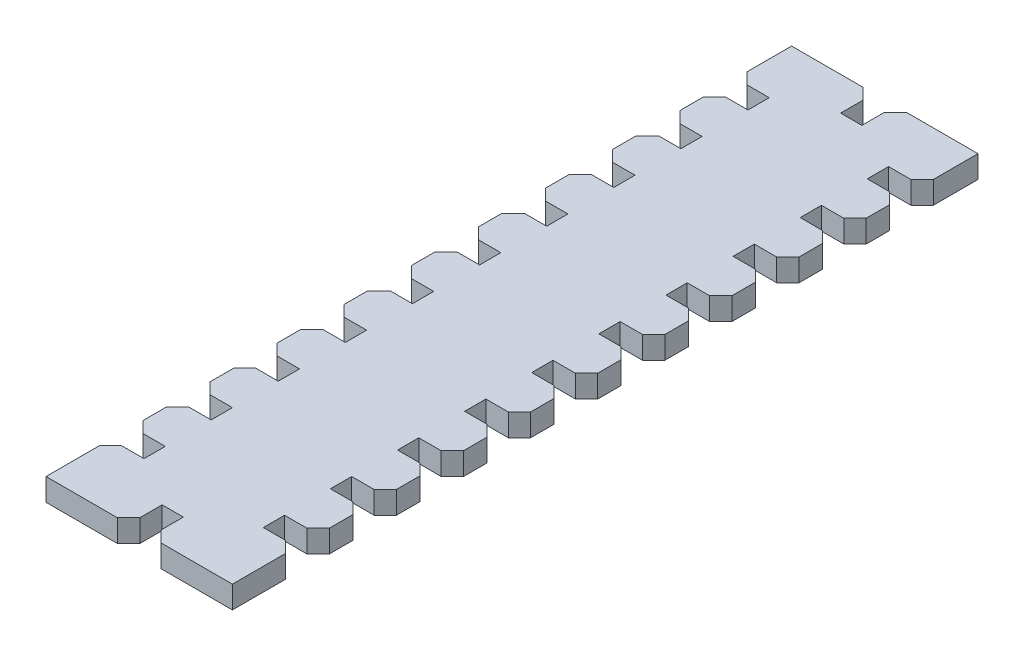
from build123d import *

# Parameters (mm, degrees)
SKETCH1_W                  = 50
SKETCH1_H                  = 200
BOSS_EXTRUDE1_DEPTH        = 6
SKETCH2_W                  = 5.7
SKETCH2_H                  = 9
CUT_EXTRUDE1_DEPTH         = 6
CHAMFER2_SIZE              = 3
SKETCH3_W                  = 9
SKETCH3_H                  = 5.7
CUT_EXTRUDE2_DEPTH         = 10
CHAMFER3_SIZE              = 3
LPATTERN1_COUNT            = 10
LPATTERN1_PITCH            = 18
CHAMFER3_OF_LPATTERN1_SIZE = 3
MIRROR3_DEPTH              = 6


# Read off the part's stored shape, not the designer's step: Mirror3
with BuildPart() as part:
    # Sketch1 → Boss-Extrude1 (new body)
    with BuildSketch(Plane(origin=(0, 0, 0), x_dir=(1, 0, 0), z_dir=(0, 1, 0))):
        with Locations((25, 100)):
            Rectangle(SKETCH1_W, SKETCH1_H)
    extrude(amount=BOSS_EXTRUDE1_DEPTH)

    # Sketch2 → Cut-Extrude1 (cut)
    with BuildSketch(Plane(origin=(0, 6, 0), x_dir=(1, 0, 0), z_dir=(0, 1, 0))):
        with Locations((25, 195.5)):
            Rectangle(SKETCH2_W, SKETCH2_H)
        with Locations((25, 4.5)):
            Rectangle(SKETCH2_W, SKETCH2_H)
    extrude(amount=-CUT_EXTRUDE1_DEPTH, mode=Mode.SUBTRACT)

    # Chamfer2
    chamfer2_edges = [part.edges().sort_by_distance(p)[0] for p in [
        (22.15, 3, -200),
        (27.85, 3, -200),
        (27.85, 3, 0),
        (22.15, 3, 0),
    ]]
    chamfer(chamfer2_edges, length=CHAMFER2_SIZE)

    # Sketch3 → Cut-Extrude2 (cut)
    with BuildSketch(Plane(origin=(0, 6, 0), x_dir=(1, 0, 0), z_dir=(0, 1, 0))):
        with Locations((45.5, 182.15)):
            Rectangle(SKETCH3_W, SKETCH3_H)
    cut_extrude2 = extrude(amount=-CUT_EXTRUDE2_DEPTH, mode=Mode.SUBTRACT)

    # Chamfer3
    chamfer3_edges = [part.edges().sort_by_distance(p)[0] for p in [
        (50, 3, -185),
        (50, 3, -179.3),
    ]]
    chamfer(chamfer3_edges, length=CHAMFER3_SIZE)

    # LPattern1: Cut-Extrude2 ×10
    with Locations(*[(0, 0, i * LPATTERN1_PITCH) for i in range(1, LPATTERN1_COUNT)]):
        add(cut_extrude2, mode=Mode.SUBTRACT)

    # Chamfer3 of LPattern1
    chamfer3_of_lpattern1_edges = [part.edges().sort_by_distance(p)[0] for p in [
        (50, 3, -167),
        (50, 3, -161.3),
        (50, 3, -149),
        (50, 3, -143.3),
        (50, 3, -131),
        (50, 3, -125.3),
        (50, 3, -113),
        (50, 3, -107.3),
        (50, 3, -95),
        (50, 3, -89.3),
        (50, 3, -77),
        (50, 3, -71.3),
        (50, 3, -59),
        (50, 3, -53.3),
        (50, 3, -41),
        (50, 3, -35.3),
        (50, 3, -23),
        (50, 3, -17.3),
    ]]
    chamfer(chamfer3_of_lpattern1_edges, length=CHAMFER3_OF_LPATTERN1_SIZE)

    # Mirror3 outline → Mirror3 (cut)
    with BuildSketch(Plane(origin=(0, 0, 0), x_dir=(1, 0, 0), z_dir=(0, 1, 0))):
        Polygon((0, 176.3), (3, 179.3), (9, 179.3), (9, 185), (3, 185), (0, 188), align=None)
        Polygon((3, 23), (0, 26), (0, 14.3), (3, 17.3), (9, 17.3), (9, 23), align=None)
        Polygon((3, 41), (0, 44), (0, 32.3), (3, 35.3), (9, 35.3), (9, 41), align=None)
        Polygon((3, 59), (0, 62), (0, 50.3), (3, 53.3), (9, 53.3), (9, 59), align=None)
        Polygon((3, 77), (0, 80), (0, 68.3), (3, 71.3), (9, 71.3), (9, 77), align=None)
        Polygon((3, 95), (0, 98), (0, 86.3), (3, 89.3), (9, 89.3), (9, 95), align=None)
        Polygon((3, 113), (0, 116), (0, 104.3), (3, 107.3), (9, 107.3), (9, 113), align=None)
        Polygon((3, 131), (0, 134), (0, 122.3), (3, 125.3), (9, 125.3), (9, 131), align=None)
        Polygon((3, 149), (0, 152), (0, 140.3), (3, 143.3), (9, 143.3), (9, 149), align=None)
        Polygon((3, 167), (0, 170), (0, 158.3), (3, 161.3), (9, 161.3), (9, 167), align=None)
    extrude(amount=MIRROR3_DEPTH, mode=Mode.SUBTRACT)


solid = part.part
